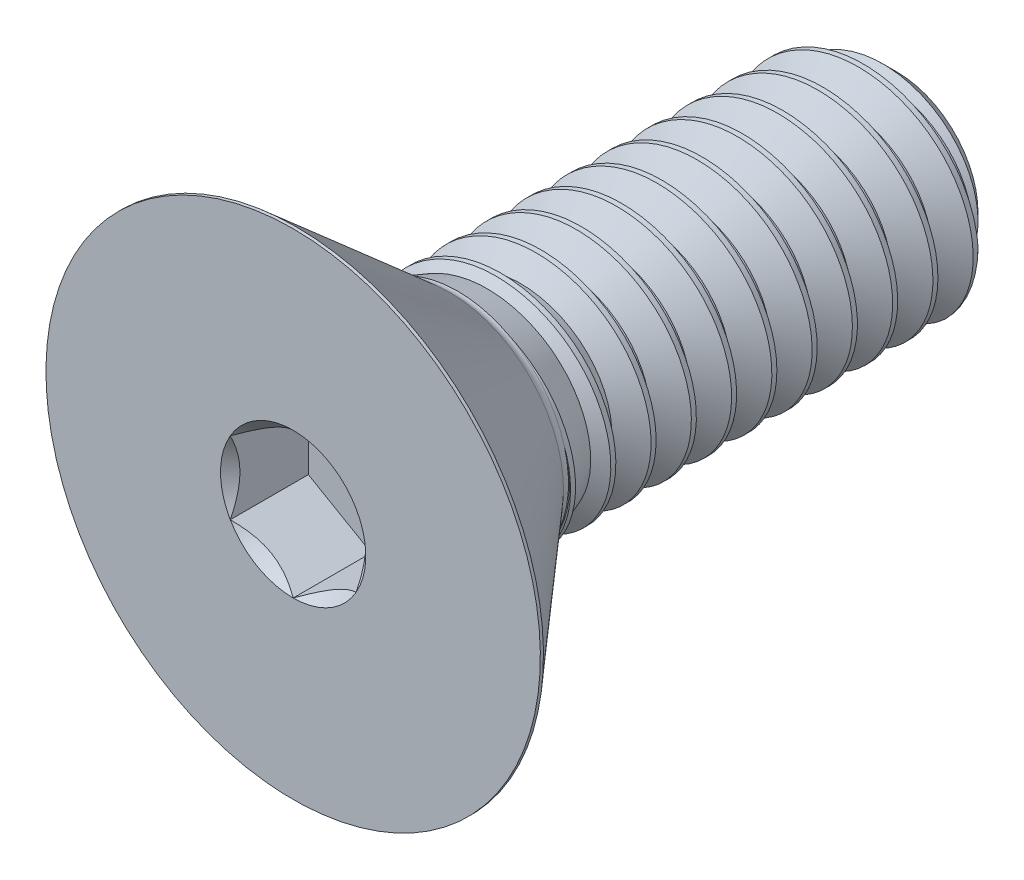
from build123d import *

# Parameters (mm, degrees)
CUT_EXTRUDE1_DEPTH = 1.2319
CUT_SWEEP1_PITCH   = 0.635
CUT_SWEEP1_TO      = 6.93446


with BuildPart() as part:
    # Sketch11 → Revolve1 (revolve)
    with BuildSketch(Plane(origin=(0, 0, 0), x_dir=(0, 0, -1), z_dir=(1, 0, 0))):
        with BuildLine():
            Line((-4.713224, 3.8989), (-2.2987, 1.799986309))
            ThreePointArc((-2.2987, 1.799986309), (-2.2396142, 1.764833952), (-2.17195956, 1.7526))
            Line((-2.17195956, 1.7526), (4.28625, 1.7526))
            Line((4.28625, 1.7526), (4.7625, 1.27635))
            Line((4.7625, 1.27635), (4.7625, 0))
            Line((4.7625, 0), (-4.7625, 0))
            Line((-4.7625, 0), (-4.7625, 3.8989))
            Line((-4.7625, 3.8989), (-4.713224, 3.8989))
        make_face()
    revolve(axis=Axis((0, 0, -4.7625), (0, 0, 1)))

    # Cut-Extrude2 cone 1 section (through the dimple's axis) → Cut-Extrude2 (revolve, cut)
    with BuildSketch(Plane(origin=(0, 0, 4.7625), x_dir=(0, -1, 0), z_dir=(1, 0, 0))):
        Polygon((0, 0), (1.14567944, 0), (0, 1.14567944), align=None)
    revolve(axis=Axis((0, 0, 4.7625), (0, 0, -1)), mode=Mode.SUBTRACT)

    # Sketch9 → Cut-Extrude1 (cut)
    with BuildSketch(Plane.XY.offset(4.7625)):
        Polygon((0.9921875, -0.57283972), (0.9921875, 0.57283972), (0, 1.14567944), (-0.9921875, 0.57283972), (-0.9921875, -0.57283972), (0, -1.14567944), align=None)
    extrude(amount=-CUT_EXTRUDE1_DEPTH, mode=Mode.SUBTRACT)


with BuildPart() as body_2:
    # Split1: the piece on the far side of the plane
    add(part.part)
    split(bisect_by=Plane.XY.offset(2.17195956), keep=Keep.BOTTOM)

    # Cut-Sweep1: arcs per turn and ends read off the stored shape
    # Cut-Sweep1: the profile of Sketch4 screwed along a right-hand helix through 15 turns, 6 arcs to a turn; built about Z, then put on its axis
    cut_sweep1_z = Axis((0, 0, 0), (0, 0, 1))
    cut_sweep1_corners = [(1.786970383, 0, 0.01984375), (1.786970383, 0, -0.57546875), (1.340155401, 0, -0.3175), (1.340155401, 0, -0.238125)]
    with BuildLine(mode=Mode.PRIVATE) as cut_sweep1_profile:
        Line(cut_sweep1_corners[0], cut_sweep1_corners[1])
        Line(cut_sweep1_corners[1], cut_sweep1_corners[2])
        Line(cut_sweep1_corners[2], cut_sweep1_corners[3])
        Line(cut_sweep1_corners[3], cut_sweep1_corners[0])
    cut_sweep1_cap = Face(cut_sweep1_profile.wire())
    cut_sweep1_turn_angles = [0, 30, 60, 90, 120, 150, 180, 210, 240, 270, 300, 330, 360]
    cut_sweep1_turn_weights = [1, 0.8660254037844387, 1, 0.8660254037844387, 1, 0.8660254037844387, 1, 0.8660254037844387, 1, 0.8660254037844387, 1, 0.8660254037844387, 1]
    cut_sweep1_turn_rails = [Edge.make_bspline([Vector(p[0], p[1], 0).rotate(cut_sweep1_z, cut_sweep1_turn_angles[k]) / cut_sweep1_turn_weights[k] + Vector(0, 0, p[2] + CUT_SWEEP1_PITCH * cut_sweep1_turn_angles[k] / 360) for k in range(13)], [0, 0, 0, 1, 1, 2, 2, 3, 3, 4, 4, 5, 5, 6, 6, 6], 2, cut_sweep1_turn_weights) for p in cut_sweep1_corners]
    cut_sweep1_turn_sides = [Face.make_surface_from_curves(cut_sweep1_turn_rails[p[0]], cut_sweep1_turn_rails[p[1]]) for p in [(0, 1), (1, 2), (2, 3), (3, 0)]]
    cut_sweep1 = Plane(origin=(0, 0, -4.7625), x_dir=(0, 1, 0), z_dir=(0, 0, 1)) * split(Solid(Shell([*[p.moved(Location((0, 0, CUT_SWEEP1_PITCH * i))) for i in range(15) for p in cut_sweep1_turn_sides], cut_sweep1_cap, cut_sweep1_cap.rotate(cut_sweep1_z, 5400).moved(Location((0, 0, CUT_SWEEP1_PITCH * 5400 / 360)))])), bisect_by=Plane.XY.offset(CUT_SWEEP1_TO), keep=Keep.BOTTOM, mode=Mode.PRIVATE)
    add(cut_sweep1, mode=Mode.SUBTRACT)


with BuildPart() as part_1:
    add(part.part)

    # Split1
    split(bisect_by=Plane.XY.offset(2.17195956), keep=Keep.TOP)

    add(body_2.part)  # Boss-Extrude2 merges body 2
    # Boss-Extrude2 cone 1 section (through the dimple's axis) → Boss-Extrude2 (revolve)
    with BuildSketch(Plane(origin=(0, 0, 2.17195956), x_dir=(0, -1, 0), z_dir=(1, 0, 0))):
        Polygon((0, 0), (1.7526, 0), (0, 4.815228925), align=None)
    revolve(axis=Axis((0, 0, 2.17195956), (0, 0, -1)))


solid = part_1.part
